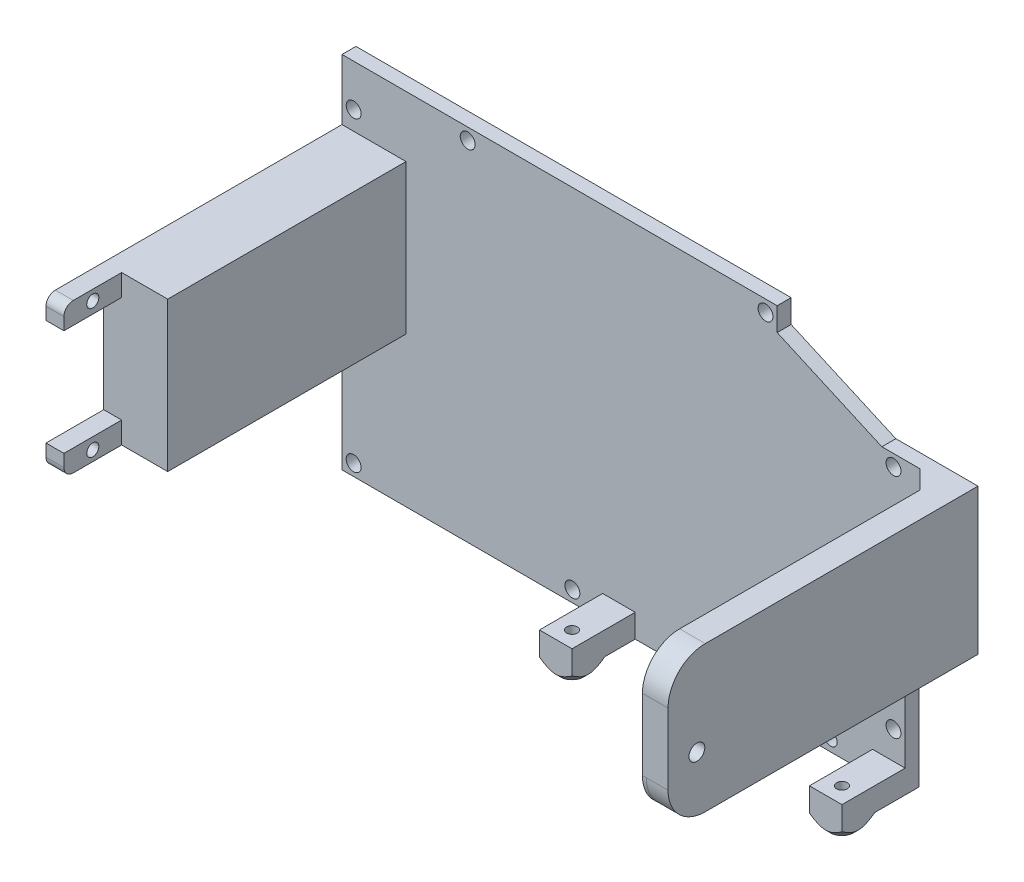
from build123d import *

# Parameters (mm, degrees)
BASE_DEPTH          = 3
SERVO_SUPPORT_DEPTH = 54.2
SERVO_MOUNTS_DEPTH  = 12.4
SERVO_SCREWS_REACH  = 146.657
SKETCH22_R          = 1.3
FILLET1_R           = 2
SKETCH23_W          = 12.651847812
SKETCH23_H          = 31.3
SHAFT_SUPPORT_DEPTH = 3
SKETCH24_W          = 5.5
SKETCH24_H          = 31.3
BOSS_EXTRUDE6_DEPTH = 66.6
FILLET2_R           = 8
FILLET3_R           = 8
SHAFT_REACH         = 152.69
SKETCH25_R          = 1.7
SCREWS_REACH        = 110.55
SKETCH26_R          = 1.6
SKETCH26_R_2        = 1.4
SKETCH31_W          = 7
SKETCH31_H          = 13.5765
BOSS_EXTRUDE8_DEPTH = 5
SKETCH30_R          = 2.5
BOSS_EXTRUDE9_DEPTH = 2.5
CUT_EXTRUDE1_REACH  = 125.131
SKETCH32_R          = 1.15
CHAMFER1_SIZE       = 2.5
CHAMFER2_SIZE       = 4


with BuildPart() as part:
    # Sketch19 → Base (new body)
    with BuildSketch(Plane.XY):
        Polygon((61.5, 19.3), (56.5, 19.3), (34, 29.3), (34, 34.3), (-59.5, 34.3), (-59.5, -43), (61.5, -43), align=None)
    extrude(amount=BASE_DEPTH)

    # Sketch20 → Servo support (add)
    with BuildSketch(Plane.XY):
        Polygon((-53.298152188, -10.85), (-55.448152188, -10.85), (-59.5, -10.85), (-59.5, 21.25), (-55.448152188, 21.25), (-53.298152188, 21.25), (-45.748152188, 21.25), (-45.748152188, 8.609473612), (-45.748152188, -10.85), align=None)
    extrude(amount=SERVO_SUPPORT_DEPTH)

    # Sketch21 → Servo mounts (add)
    with BuildSketch(Plane.XY.offset(54.2)):
        Polygon((-55.848152188, -6.2), (-59.5, -6.2), (-59.5, -10.85), (-55.648152188, -10.85), (-55.648152188, -6.2), align=None)
        Polygon((-55.848152188, 16.6), (-59.5, 16.6), (-59.5, 21.25), (-55.648152188, 21.25), (-55.648152188, 16.6), align=None)
    extrude(amount=SERVO_MOUNTS_DEPTH)

    # Sketch22 → Servo screws (cut, up to next)
    with BuildSketch(Plane.ZY.offset(59.5), mode=Mode.PRIVATE) as servo_screws_sk1:
        with Locations(Location((60.4, -8.65, 0), (0, 0, 270))):
            Circle(SKETCH22_R)
    servo_screws_tool1 = extrude(servo_screws_sk1.sketch, amount=-SERVO_SCREWS_REACH, mode=Mode.PRIVATE) & part.part
    # Sketch22 → Servo screws (cut, up to next)
    with BuildSketch(Plane.ZY.offset(59.5), mode=Mode.PRIVATE) as servo_screws_sk2:
        with Locations(Location((60.4, 19.05, 0), (0, 0, 270))):
            Circle(SKETCH22_R)
    servo_screws_tool2 = extrude(servo_screws_sk2.sketch, amount=-SERVO_SCREWS_REACH, mode=Mode.PRIVATE) & part.part
    add(servo_screws_tool1.solids().sort_by_distance((-59.5, -8.65, 60.4))[0], mode=Mode.SUBTRACT)
    add(servo_screws_tool2.solids().sort_by_distance((-59.5, 19.05, 60.4))[0], mode=Mode.SUBTRACT)

    # Fillet1
    fillet1_edges = [part.edges().sort_by_distance(p)[0] for p in [
        (-57.574076094, 21.25, 66.6),
        (-57.574076094, -10.85, 66.6),
    ]]
    fillet(fillet1_edges, radius=FILLET1_R)

    # Sketch23 → Shaft support (add)
    with BuildSketch(Plane.XY):
        with Locations((67.825923906, 3.65)):
            Rectangle(SKETCH23_W, SKETCH23_H)
    extrude(amount=SHAFT_SUPPORT_DEPTH)

    # Sketch24 → Boss-Extrude6 (add)
    with BuildSketch(Plane.XY):
        with Locations((71.401847812, 3.65)):
            Rectangle(SKETCH24_W, SKETCH24_H)
    extrude(amount=BOSS_EXTRUDE6_DEPTH)

    # Fillet2
    fillet2_edges = [part.edges().sort_by_distance(p)[0] for p in [
        (61.5, -12, 1.5),
    ]]
    fillet(fillet2_edges, radius=FILLET2_R)

    # Fillet3
    fillet3_edges = [part.edges().sort_by_distance(p)[0] for p in [
        (71.401847812, 19.3, 66.6),
        (71.825923906, -12, 66.6),
        (69.075325128, -12.011279749, 66.6),
    ]]
    fillet(fillet3_edges, radius=FILLET3_R)

    # Sketch25 → Shaft (cut, up to next)
    with BuildSketch(Plane.ZY.offset(-68.651847812), mode=Mode.PRIVATE) as shaft_sk1:
        with Locations((60.4, 0)):
            Circle(SKETCH25_R)
    shaft_tool1 = extrude(shaft_sk1.sketch, amount=-SHAFT_REACH, mode=Mode.PRIVATE) & part.part
    add(shaft_tool1.solids().sort_by_distance((68.651848, 0, 60.4))[0], mode=Mode.SUBTRACT)

    # Sketch26 → Screws (cut, up to next)
    with BuildSketch(Plane.XY, mode=Mode.PRIVATE) as screws_sk1:
        with Locations((-57, -40.5)):
            Circle(SKETCH26_R)
    screws_tool1 = extrude(screws_sk1.sketch, amount=SCREWS_REACH, mode=Mode.PRIVATE) & part.part
    # Sketch26 → Screws (cut, up to next)
    with BuildSketch(Plane.XY, mode=Mode.PRIVATE) as screws_sk2:
        with Locations((-10, -40.5)):
            Circle(SKETCH26_R)
    screws_tool2 = extrude(screws_sk2.sketch, amount=SCREWS_REACH, mode=Mode.PRIVATE) & part.part
    # Sketch26 → Screws (cut, up to next)
    with BuildSketch(Plane.XY, mode=Mode.PRIVATE) as screws_sk3:
        with Locations((59, -32)):
            Circle(SKETCH26_R)
    screws_tool3 = extrude(screws_sk3.sketch, amount=SCREWS_REACH, mode=Mode.PRIVATE) & part.part
    # Sketch26 → Screws (cut, up to next)
    with BuildSketch(Plane.XY, mode=Mode.PRIVATE) as screws_sk4:
        with Locations((59, 16.8)):
            Circle(SKETCH26_R)
    screws_tool4 = extrude(screws_sk4.sketch, amount=SCREWS_REACH, mode=Mode.PRIVATE) & part.part
    # Sketch26 → Screws (cut, up to next)
    with BuildSketch(Plane.XY, mode=Mode.PRIVATE) as screws_sk5:
        with Locations((31.5, 31.8)):
            Circle(SKETCH26_R)
    screws_tool5 = extrude(screws_sk5.sketch, amount=SCREWS_REACH, mode=Mode.PRIVATE) & part.part
    # Sketch26 → Screws (cut, up to next)
    with BuildSketch(Plane.XY, mode=Mode.PRIVATE) as screws_sk6:
        with Locations((-32.5, 31.8)):
            Circle(SKETCH26_R)
    screws_tool6 = extrude(screws_sk6.sketch, amount=SCREWS_REACH, mode=Mode.PRIVATE) & part.part
    # Sketch26 → Screws (cut, up to next)
    with BuildSketch(Plane.XY, mode=Mode.PRIVATE) as screws_sk7:
        with Locations((-57, 25.3)):
            Circle(SKETCH26_R)
    screws_tool7 = extrude(screws_sk7.sketch, amount=SCREWS_REACH, mode=Mode.PRIVATE) & part.part
    # Sketch26 → Screws (cut, up to next)
    with BuildSketch(Plane.XY, mode=Mode.PRIVATE) as screws_sk8:
        with Locations((-57, -14.5)):
            Circle(SKETCH26_R_2)
    screws_tool8 = extrude(screws_sk8.sketch, amount=SCREWS_REACH, mode=Mode.PRIVATE) & part.part
    # Sketch26 → Screws (cut, up to next)
    with BuildSketch(Plane.XY, mode=Mode.PRIVATE) as screws_sk9:
        with Locations((45.5, -40.5)):
            Circle(SKETCH26_R_2)
    screws_tool9 = extrude(screws_sk9.sketch, amount=SCREWS_REACH, mode=Mode.PRIVATE) & part.part
    add(screws_tool1.solids().sort_by_distance((-57, -40.5, 0))[0], mode=Mode.SUBTRACT)
    add(screws_tool2.solids().sort_by_distance((-10, -40.5, 0))[0], mode=Mode.SUBTRACT)
    add(screws_tool3.solids().sort_by_distance((59, -32, 0))[0], mode=Mode.SUBTRACT)
    add(screws_tool4.solids().sort_by_distance((59, 16.8, 0))[0], mode=Mode.SUBTRACT)
    add(screws_tool5.solids().sort_by_distance((31.5, 31.8, 0))[0], mode=Mode.SUBTRACT)
    add(screws_tool6.solids().sort_by_distance((-32.5, 31.8, 0))[0], mode=Mode.SUBTRACT)
    add(screws_tool7.solids().sort_by_distance((-57, 25.3, 0))[0], mode=Mode.SUBTRACT)
    add(screws_tool8.solids().sort_by_distance((-57, -14.5, 0))[0], mode=Mode.SUBTRACT)
    add(screws_tool9.solids().sort_by_distance((45.5, -40.5, 0))[0], mode=Mode.SUBTRACT)

    # Sketch31 → Boss-Extrude8 (add)
    with BuildSketch(Plane.XZ.offset(43)):
        with Locations((0, 9.78825)):
            Rectangle(SKETCH31_W, SKETCH31_H)
        with Locations((58, 9.78825)):
            Rectangle(SKETCH31_W, SKETCH31_H)
    extrude(amount=-BOSS_EXTRUDE8_DEPTH)

    # Sketch30 → Boss-Extrude9 (add)
    with BuildSketch(Plane.XZ.offset(43)):
        with Locations(Location((0, 13.0765, 0), (0, 0, 180))):
            Circle(SKETCH30_R)
        with Locations(Location((58, 13.0765, 0), (0, 0, 180))):
            Circle(SKETCH30_R)
    extrude(amount=BOSS_EXTRUDE9_DEPTH)

    # Sketch32 → Cut-Extrude1 (cut, up to next)
    with BuildSketch(Plane(origin=(0, -38, 0), x_dir=(1, 0, 0), z_dir=(0, 1, 0)), mode=Mode.PRIVATE) as cut_extrude1_sk1:
        with Locations(Location((0, -13.0765, 0), (0, 0, 270))):
            Circle(SKETCH32_R)
    cut_extrude1_tool1 = extrude(cut_extrude1_sk1.sketch, amount=-CUT_EXTRUDE1_REACH, mode=Mode.PRIVATE) & part.part
    # Sketch32 → Cut-Extrude1 (cut, up to next)
    with BuildSketch(Plane(origin=(0, -38, 0), x_dir=(1, 0, 0), z_dir=(0, 1, 0)), mode=Mode.PRIVATE) as cut_extrude1_sk2:
        with Locations(Location((58, -13.0765, 0), (0, 0, 270))):
            Circle(SKETCH32_R)
    cut_extrude1_tool2 = extrude(cut_extrude1_sk2.sketch, amount=-CUT_EXTRUDE1_REACH, mode=Mode.PRIVATE) & part.part
    add(cut_extrude1_tool1.solids().sort_by_distance((0, -38, 13.0765))[0], mode=Mode.SUBTRACT)
    add(cut_extrude1_tool2.solids().sort_by_distance((58, -38, 13.0765))[0], mode=Mode.SUBTRACT)

    # Chamfer1
    # the kernel refuses this chamfer: 2.5 mm, written as the material it adds along each edge
    with BuildSketch(Plane(origin=(58, -43, 13.0765), x_dir=(-1, 0, 0), z_dir=(0, 0, 1))) as chamfer1_piece_1_section:
        Polygon((2.5 + CHAMFER1_SIZE, 0), (2.5, CHAMFER1_SIZE), (2.5, 0), align=None)
    chamfer1_piece_1 = revolve(axis=Axis((58, -43, 13.0765), (0, -1, 0)), mode=Mode.PRIVATE)
    chamfer1_piece_1 = split(chamfer1_piece_1, bisect_by=Plane(origin=(61.5, -43.330528144, 9.079752975), z_dir=(-1, 0, 0)), keep=Keep.TOP, mode=Mode.PRIVATE)
    chamfer1_piece_1 = split(chamfer1_piece_1, bisect_by=Plane(origin=(54.5, -43.330528144, 9.079752975), z_dir=(1, 0, 0)), keep=Keep.TOP, mode=Mode.PRIVATE)
    chamfer1_piece_1 = split(chamfer1_piece_1, bisect_by=Plane(origin=(55.692477029, -43.330528144, 16.5765), z_dir=(0, 0, -1)), keep=Keep.TOP, mode=Mode.PRIVATE)
    chamfer1_piece_1 = split(chamfer1_piece_1, bisect_by=Plane(origin=(55.692477029, -45.5, 9.079752975), z_dir=(0, 1, 0)), keep=Keep.TOP, mode=Mode.PRIVATE)
    add(chamfer1_piece_1)
    with BuildSketch(Plane(origin=(0, -43, 13.0765), x_dir=(-1, 0, 0), z_dir=(0, 0, 1))) as chamfer1_piece_2_section:
        Polygon((2.5 + CHAMFER1_SIZE, 0), (2.5, CHAMFER1_SIZE), (2.5, 0), align=None)
    chamfer1_piece_2 = revolve(axis=Axis((0, -43, 13.0765), (0, -1, 0)), mode=Mode.PRIVATE)
    chamfer1_piece_2 = split(chamfer1_piece_2, bisect_by=Plane(origin=(-3.5, -43.330528144, 9.079752976), z_dir=(1, 0, 0)), keep=Keep.TOP, mode=Mode.PRIVATE)
    chamfer1_piece_2 = split(chamfer1_piece_2, bisect_by=Plane(origin=(-2.30752297, -43.330528144, 16.5765), z_dir=(0, 0, -1)), keep=Keep.TOP, mode=Mode.PRIVATE)
    chamfer1_piece_2 = split(chamfer1_piece_2, bisect_by=Plane(origin=(3.5, -43.330528144, 9.079752976), z_dir=(-1, 0, 0)), keep=Keep.TOP, mode=Mode.PRIVATE)
    chamfer1_piece_2 = split(chamfer1_piece_2, bisect_by=Plane(origin=(-2.30752297, -45.5, 9.079752976), z_dir=(0, 1, 0)), keep=Keep.TOP, mode=Mode.PRIVATE)
    add(chamfer1_piece_2)

    # Chamfer2
    chamfer2_edges = [part.edges().sort_by_distance(p)[0] for p in [
        (68.651847812, 3.627456407, 3),
    ]]
    chamfer(chamfer2_edges, length=CHAMFER2_SIZE)


solid = part.part
